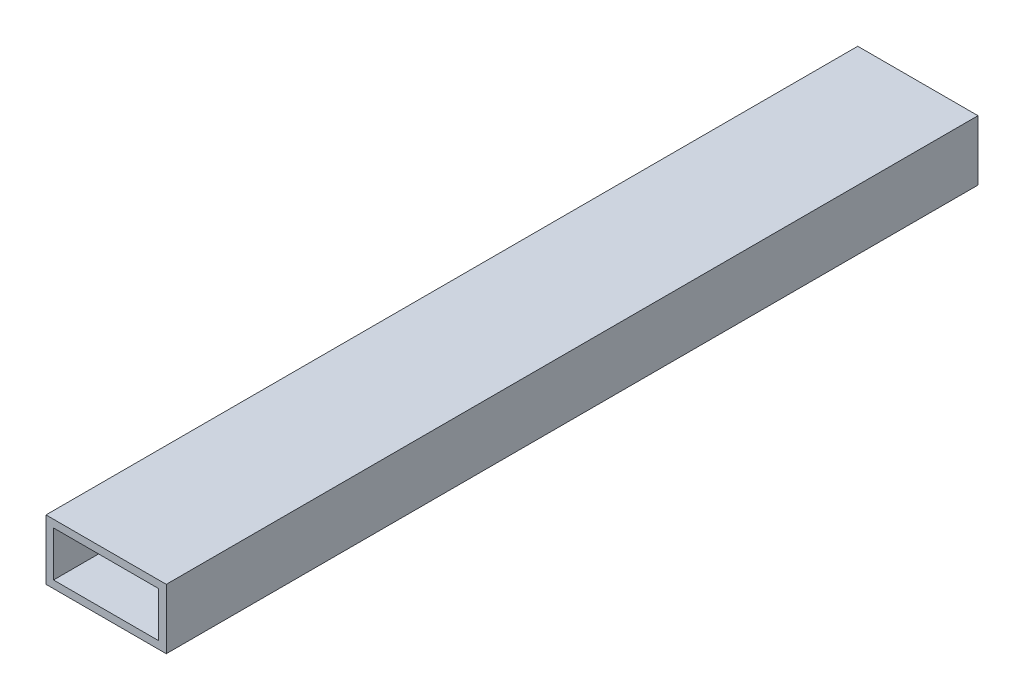
from build123d import *

# Parameters (mm, degrees)
SKETCH1_W           = 50.8
SKETCH1_H           = 342.9
BOSS_EXTRUDE1_DEPTH = 25.4
SHELL1_T            = -3.175


with BuildPart() as part:
    # Sketch1 → Boss-Extrude1 (new body)
    with BuildSketch(Plane(origin=(0, 0, 0), x_dir=(1, 0, 0), z_dir=(0, 1, 0))):
        with Locations((25.4, 171.45)):
            Rectangle(SKETCH1_W, SKETCH1_H)
    extrude(amount=BOSS_EXTRUDE1_DEPTH)

    # Shell1
    shell1_openings = [part.faces().sort_by_distance(p)[0] for p in [
        (25.4, 12.7, -342.9),
        (25.4, 12.7, 0),
    ]]
    offset(amount=SHELL1_T, openings=shell1_openings, kind=Kind.INTERSECTION)


solid = part.part
